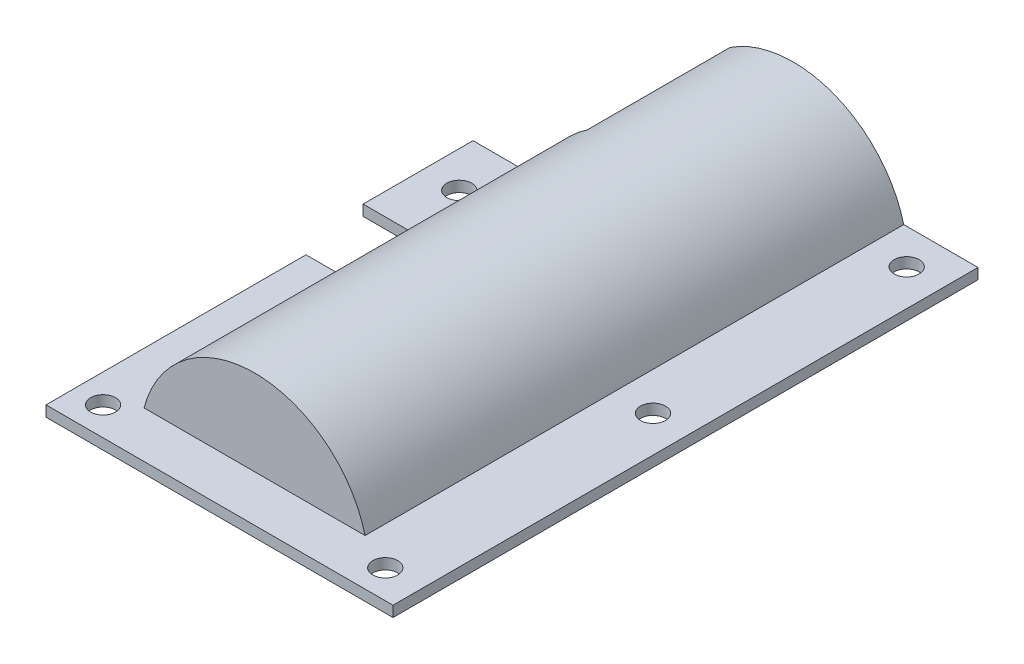
from build123d import *

# Parameters (mm, degrees)
BOSS_EXTRUDE1_DEPTH = 72.5
BOSS_EXTRUDE2_DEPTH = 1.5
BOSS_EXTRUDE3_START = 1.5
BOSS_EXTRUDE3_DEPTH = 1.5
SKETCH4_R           = 1.75
SKETCH4_W           = 26.83281573
SKETCH4_H           = 72.5
BOSS_EXTRUDE4_DEPTH = 1.5
SKETCH5_W           = 16
SKETCH5_H           = 20
CUT_EXTRUDE1_DEPTH  = 15
SKETCH6_W           = 11.473592135
SKETCH6_H           = 10.16
CUT_EXTRUDE2_DEPTH  = 10


with BuildPart() as part:
    # Sketch1 → Boss-Extrude1 (new body)
    with BuildSketch(Plane.XY):
        with BuildLine():
            ThreePointArc((15.491933385, 4), (0, 16), (-15.491933385, 4))
            Line((-15.491933385, 4), (-13.416407865, 4))
            ThreePointArc((-13.416407865, 4), (0, 14), (13.416407865, 4))
            Line((13.416407865, 4), (15.491933385, 4))
        make_face()
    extrude(amount=BOSS_EXTRUDE1_DEPTH)

    # Sketch2 → Boss-Extrude2 (add)
    with BuildSketch(Plane.XY.offset(72.5)):
        with BuildLine():
            Line((-15.491933385, 4), (15.491933385, 4))
            ThreePointArc((15.491933385, 4), (0, 16), (-15.491933385, 4))
        make_face()
    extrude(amount=BOSS_EXTRUDE2_DEPTH)

    # Sketch3 → Boss-Extrude3 (add)
    with BuildSketch(Plane(origin=(0, 0, 0), x_dir=(-1, 0, 0), z_dir=(0, 0, -1)).offset(BOSS_EXTRUDE3_START)):
        with BuildLine():
            Line((-15.491933385, 4), (15.491933385, 4))
            ThreePointArc((15.491933385, 4), (0, 16), (-15.491933385, 4))
        make_face()
    extrude(amount=-BOSS_EXTRUDE3_DEPTH)

    # Sketch4 → Boss-Extrude4 (add)
    with BuildSketch(Plane.XZ.offset(-4)):
        Polygon((25.9, 80.5), (-22.74, 80.5), (-22.74, 44.06), (-24.89, 44.06), (-24.89, -1.5), (25.9, -1.5), align=None)
        with Locations((-19.81, 25.5)):
            Circle(SKETCH4_R, mode=Mode.SUBTRACT)
        with Locations((20.82, 3.42)):
            Circle(SKETCH4_R, mode=Mode.SUBTRACT)
        with Locations((20.82, 38.98)):
            Circle(SKETCH4_R, mode=Mode.SUBTRACT)
        with Locations((-18.74, 76.5)):
            Circle(SKETCH4_R, mode=Mode.SUBTRACT)
        with Locations((20.82, 76.5)):
            Circle(SKETCH4_R, mode=Mode.SUBTRACT)
        with Locations((0, 36.25)):
            Rectangle(SKETCH4_W, SKETCH4_H, mode=Mode.SUBTRACT)
    extrude(amount=BOSS_EXTRUDE4_DEPTH)

    # Sketch5 → Cut-Extrude1 (cut)
    with BuildSketch(Plane.XZ.offset(-2.5)):
        with Locations((-16.89, 8.5)):
            Rectangle(SKETCH5_W, SKETCH5_H)
    extrude(amount=-CUT_EXTRUDE1_DEPTH, mode=Mode.SUBTRACT)

    # Sketch6 → Cut-Extrude2 (cut)
    with BuildSketch(Plane.XZ.offset(-2.5)):
        with Locations((-19.153203932, 38.98)):
            Rectangle(SKETCH6_W, SKETCH6_H)
    extrude(amount=-CUT_EXTRUDE2_DEPTH, mode=Mode.SUBTRACT)


solid = part.part
